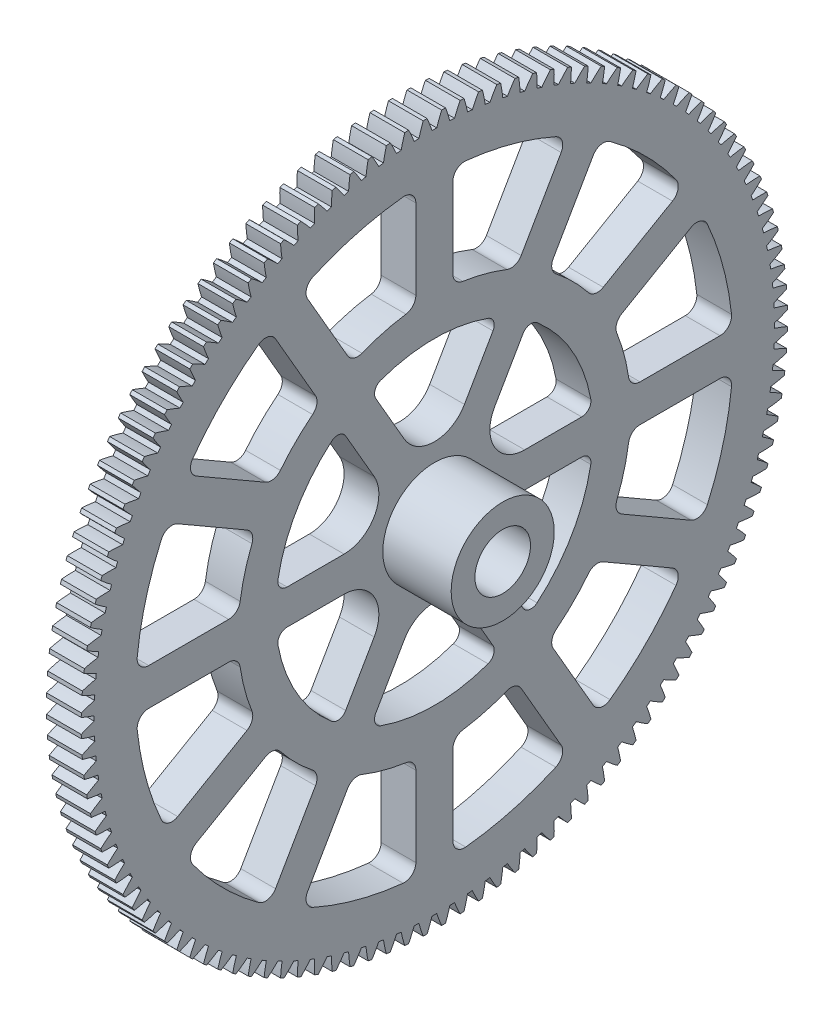
from build123d import *

# Parameters (mm, degrees)
BASPROSKE_W                        = 2.999999999999999
BASPROSKE_H                        = 30.500000000000004
TOOTHCUT_DEPTH                     = 44.23771501825693
TEETHCUTS_COUNT                    = 120
TEETHCUTS_ANGLE                    = 357.0000000000008
BORSKE_R                           = 2.4
BORE_DEPTH                         = 50.0000508
BOSS_EXTRU_1_START                 = 5.9
ESQUISSE1_R                        = 4.45
ESQUISSE1_R_2                      = 2.4
BOSS_EXTRU_1_DEPTH                 = 5.9
ENL_V_MAT_EXTRU_1_DEPTH            = 45.033123414682684
CONG_1_R                           = 0.8
R_P_TITION_CIRCULAIRE1_COUNT       = 6
CONG_1_OF_R_P_TITION_CIRCULAIRE1_R = 0.8
ENL_V_MAT_EXTRU_2_DEPTH            = 44.526037697597474
CONG_2_R                           = 1
R_P_TITION_CIRCULAIRE2_COUNT       = 12
CONG_2_OF_R_P_TITION_CIRCULAIRE2_R = 1


with BuildPart() as part:
    # BasProSke → Base-Revolve (revolve)
    with BuildSketch(Plane(origin=(0, 0, 0), x_dir=(1, 0, 0), z_dir=(0, 1, 0)), mode=Mode.PRIVATE) as base_revolve_sk:
        with Locations((1.4999999999999996, 15.250000000000002)):
            Rectangle(BASPROSKE_W, BASPROSKE_H)
    revolve(base_revolve_sk.sketch.rotate(Axis((-10, 0, 0), (1, 0, 0)), 180), axis=Axis((-10, 0, 0), (1, 0, 0)))

    # TooCutSke → ToothCut (cut, through all)
    with BuildSketch(Plane(origin=(0, 0, 0), x_dir=(0, 0, -1), z_dir=(1, 0, 0))):
        with BuildLine():
            ThreePointArc((0.20519538672936152, 29.373283283508925), (1.8e-15, 29.374), (-0.20519538672936152, 29.373283283508925))
            ThreePointArc((-0.20519538672936152, 29.373283283508925), (-0.4085395269921097, 29.95154367391185), (-0.6411468317509667, 30.51866602425696))
            ThreePointArc((-0.6411468317509667, 30.51866602425696), (1.87e-15, 30.525400000000005), (0.6411468317509667, 30.51866602425696))
            ThreePointArc((0.6411468317509667, 30.51866602425696), (0.4085395269921097, 29.951543673911853), (0.20519538672936152, 29.373283283508925))
        make_face()
    toothcut = extrude(amount=TOOTHCUT_DEPTH, mode=Mode.SUBTRACT)

    # TeethCuts: ToothCut ×120 about axis
    teethcuts_axis = Axis((-10, 0, 0), (1, 0, 0))
    for i in range(1, TEETHCUTS_COUNT):
        add(toothcut.rotate(teethcuts_axis, i * TEETHCUTS_ANGLE / (TEETHCUTS_COUNT - 1)), mode=Mode.SUBTRACT)

    # BorSke → Bore (cut, symmetric)
    with BuildSketch(Plane(origin=(0, 0, 0), x_dir=(0, 0, -1), z_dir=(1, 0, 0))):
        with Locations(Location((0, 0, 0), (0, 0, 180))):
            Circle(BORSKE_R)
    extrude(amount=BORE_DEPTH, both=True, mode=Mode.SUBTRACT)

    # Esquisse1 → Boss.-Extru.1 (add)
    with BuildSketch(Plane(origin=(2.999999999999999, 0, 0), x_dir=(0, 0, -1), z_dir=(1, 0, 0)).offset(BOSS_EXTRU_1_START)):
        with Locations(Location((0, 0, 0), (0, 0, 180))):
            Circle(ESQUISSE1_R)
        Circle(ESQUISSE1_R_2, mode=Mode.SUBTRACT)
    extrude(amount=-BOSS_EXTRU_1_DEPTH)

    # Esquisse2 → Enlèv. mat.-Extru.1 (cut, through all)
    with BuildSketch(Plane.ZY):
        with BuildLine():
            Line((-5.522355172092939, 12.5649997355057), (-2.598076211353333, 7.500000000000007))
            ThreePointArc((-2.598076211353333, 7.500000000000007), (7.6e-16, 5.999999999999999), (2.598076211353333, 7.500000000000007))
            Line((2.598076211353333, 7.500000000000007), (5.522355172092939, 12.5649997355057))
            ThreePointArc((5.522355172092939, 12.5649997355057), (8.4e-16, 13.724999999999998), (-5.522355172092939, 12.5649997355057))
        make_face()
    enl_v_mat_extru_1 = extrude(amount=-ENL_V_MAT_EXTRU_1_DEPTH, mode=Mode.SUBTRACT)

    # Congé1
    cong_1_edges = [part.edges().sort_by_distance(p)[0] for p in [
        (1.5, 12.564999735505701, -5.522355172092939),
        (1.5, 12.564999735505701, 5.52235517209294),
    ]]
    fillet(cong_1_edges, radius=CONG_1_R)

    # Répétition circulaire1: Enlèv. mat.-Extru.1 ×6 about axis
    r_p_tition_circulaire1_axis = Axis((0, -3.2e-16, -7.46e-15), (1, 0, 0))
    for i in range(1, R_P_TITION_CIRCULAIRE1_COUNT):
        add(enl_v_mat_extru_1.rotate(r_p_tition_circulaire1_axis, i * 360 / R_P_TITION_CIRCULAIRE1_COUNT), mode=Mode.SUBTRACT)

    # Congé1 of Répétition circulaire1
    cong_1_of_r_p_tition_circulaire1_edges = [part.edges().sort_by_distance(p)[0] for p in [
        (1.5, 11.064999735505715, 8.120431383446215),
        (1.5, 1.4999999999999747, 13.642786555539155),
        (1.5, -1.4999999999999838, 13.642786555539148),
        (1.5, -11.064999735505726, 8.120431383446212),
        (1.5, -12.564999735505701, 5.522355172092926),
        (1.5, -12.564999735505701, -5.522355172092953),
        (1.5, -11.06499973550572, -8.120431383446226),
        (1.5, -1.4999999999999798, -13.642786555539171),
        (1.5, 1.4999999999999876, -13.642786555539162),
        (1.5, 11.06499973550573, -8.120431383446222),
    ]]
    fillet(cong_1_of_r_p_tition_circulaire1_edges, radius=CONG_1_OF_R_P_TITION_CIRCULAIRE1_R)

    # Esquisse4 → Enlèv. mat.-Extru.2 (cut, through all)
    with BuildSketch(Plane(origin=(2.999999999999999, 0, 0), x_dir=(0, 0, -1), z_dir=(1, 0, 0))):
        with BuildLine():
            Line((-1.6000000000000003, 16.874314800903772), (-1.5999999999999999, 25.750339803583177))
            ThreePointArc((-1.5999999999999999, 25.750339803583177), (-6.677531363645049, 24.920886318257963), (-11.489529255736523, 23.10044842598461))
            Line((-11.489529255736523, 23.10044842598461), (-7.051516754396807, 15.41358528903841))
            ThreePointArc((-7.051516754396807, 15.41358528903841), (-4.38698281448774, 16.37244275559971), (-1.6000000000000003, 16.874314800903772))
        make_face()
    enl_v_mat_extru_2 = extrude(amount=-ENL_V_MAT_EXTRU_2_DEPTH, mode=Mode.SUBTRACT)

    # Congé2
    cong_2_edges = [part.edges().sort_by_distance(p)[0] for p in [
        (1.4999999999999996, 23.100448425984606, 11.489529255736521),
        (1.4999999999999996, 25.750339803583174, 1.5999999999999996),
        (1.4999999999999996, 16.87431480090377, 1.600000000000001),
        (1.4999999999999996, 15.41358528903841, 7.051516754396808),
    ]]
    fillet(cong_2_edges, radius=CONG_2_R)

    # Répétition circulaire2: Enlèv. mat.-Extru.2 ×12 about axis
    r_p_tition_circulaire2_axis = Axis((0, 1.53e-15, -6.51e-15), (1, 0, 0))
    for i in range(1, R_P_TITION_CIRCULAIRE2_COUNT):
        add(enl_v_mat_extru_2.rotate(r_p_tition_circulaire2_axis, i * 360 / R_P_TITION_CIRCULAIRE2_COUNT), mode=Mode.SUBTRACT)

    # Congé2 of Répétition circulaire2
    cong_2_of_r_p_tition_circulaire2_edges = [part.edges().sort_by_distance(p)[0] for p in [
        (1.4999999999999996, 14.260810547846656, 21.500448425984644),
        (1.4999999999999996, 21.50044842598462, 14.260810547846685),
        (1.4999999999999996, 13.813585289038413, 9.822798046506984),
        (1.4999999999999996, 9.822798046506966, 13.813585289038434),
        (1.4999999999999996, 1.5999999999999592, 25.750339803583174),
        (1.4999999999999996, 11.489529255736484, 23.100448425984617),
        (1.4999999999999996, 7.051516754396779, 15.41358528903841),
        (1.4999999999999996, 1.5999999999999726, 16.874314800903772),
        (1.4999999999999996, -11.489529255736525, 23.1004484259846),
        (1.4999999999999996, -1.600000000000003, 25.750339803583167),
        (1.4999999999999996, -1.6000000000000048, 16.87431480090376),
        (1.4999999999999996, -7.051516754396812, 15.413585289038402),
        (1.4999999999999996, -21.500448425984644, 14.260810547846653),
        (1.4999999999999996, -14.260810547846686, 21.50044842598461),
        (1.4999999999999996, -9.822798046506987, 13.813585289038405),
        (1.4999999999999996, -13.813585289038436, 9.82279804650696),
        (1.4999999999999996, -25.75033980358318, 1.599999999999946),
        (1.4999999999999996, -23.100448425984624, 11.489529255736471),
        (1.4999999999999996, -15.413585289038418, 7.051516754396766),
        (1.4999999999999996, -16.874314800903775, 1.599999999999961),
        (1.4999999999999996, -23.100448425984602, -11.48952925573653),
        (1.4999999999999996, -25.75033980358317, -1.6000000000000096),
        (1.4999999999999996, -16.874314800903765, -1.600000000000012),
        (1.4999999999999996, -15.413585289038407, -7.051516754396819),
        (1.4999999999999996, -14.260810547846651, -21.500448425984654),
        (1.4999999999999996, -21.50044842598461, -14.260810547846702),
        (1.4999999999999996, -13.813585289038409, -9.822798046507),
        (1.4999999999999996, -9.822798046506962, -13.813585289038446),
        (1.4999999999999996, -1.5999999999999668, -25.750339803583188),
        (1.4999999999999996, -11.489529255736489, -23.10044842598462),
        (1.4999999999999996, -7.051516754396781, -15.413585289038421),
        (1.4999999999999996, -1.5999999999999766, -16.874314800903782),
        (1.4999999999999996, 11.489529255736526, -23.100448425984613),
        (1.4999999999999996, 1.600000000000003, -25.750339803583177),
        (1.4999999999999996, 1.6000000000000059, -16.874314800903772),
        (1.4999999999999996, 7.051516754396813, -15.413585289038418),
        (1.4999999999999996, 21.50044842598465, -14.260810547846658),
        (1.4999999999999996, 14.260810547846699, -21.500448425984622),
        (1.4999999999999996, 9.822798046506996, -13.813585289038416),
        (1.4999999999999996, 13.813585289038443, -9.82279804650697),
        (1.4999999999999996, 25.750339803583184, -1.5999999999999748),
        (1.4999999999999996, 23.100448425984617, -11.489529255736496),
        (1.4999999999999996, 15.413585289038416, -7.051516754396789),
        (1.4999999999999996, 16.87431480090378, -1.5999999999999845),
    ]]
    fillet(cong_2_of_r_p_tition_circulaire2_edges, radius=CONG_2_OF_R_P_TITION_CIRCULAIRE2_R)


solid = part.part
